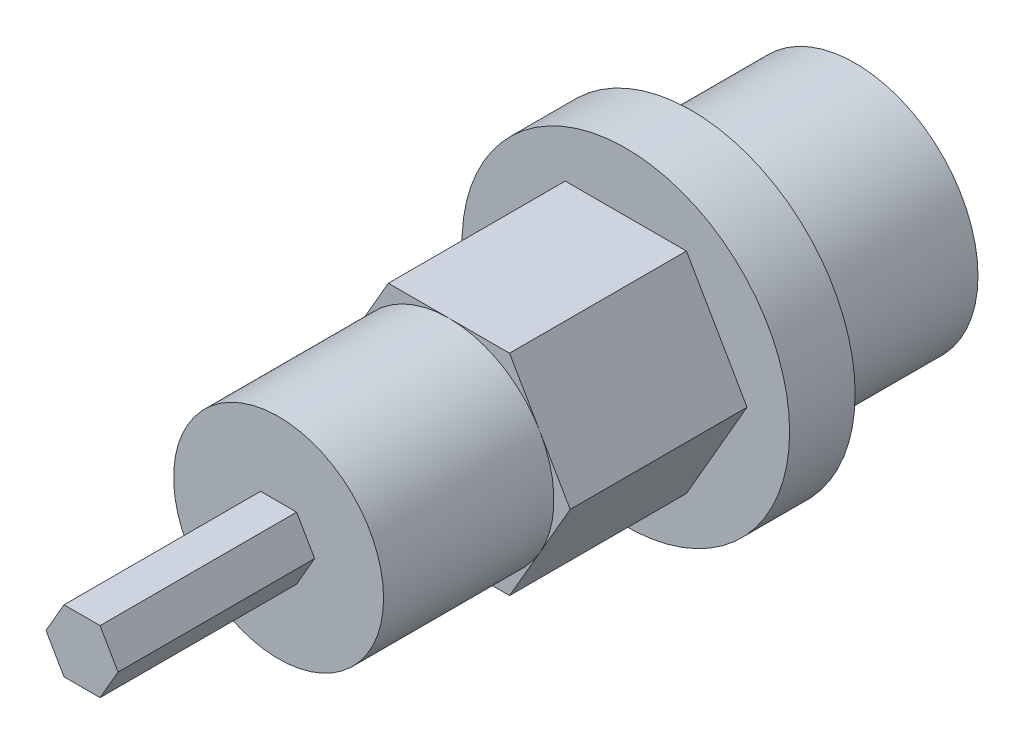
from build123d import *

# Parameters (mm, degrees)
SKETCH1_R           = 3.75
BOSS_EXTRUDE1_DEPTH = 5
SKETCH2_R           = 5
BOSS_EXTRUDE2_DEPTH = 2
BOSS_EXTRUDE3_DEPTH = 5.4
SKETCH4_R           = 3.204293994
BOSS_EXTRUDE4_DEPTH = 5.2
BOSS_EXTRUDE5_DEPTH = 6


with BuildPart() as part:
    # Sketch1 → Boss-Extrude1 (new body)
    with BuildSketch(Plane.XY):
        Circle(SKETCH1_R)
    extrude(amount=BOSS_EXTRUDE1_DEPTH)

    # Sketch2 → Boss-Extrude2 (add)
    with BuildSketch(Plane.XY.offset(5)):
        Circle(SKETCH2_R)
    extrude(amount=BOSS_EXTRUDE2_DEPTH)

    # Sketch3 → Boss-Extrude3 (add)
    with BuildSketch(Plane.XY.offset(7)):
        Polygon((3.7, 0), (1.85, 3.204293994), (-1.85, 3.204293994), (-3.7, 0), (-1.85, -3.204293994), (1.85, -3.204293994), align=None)
    extrude(amount=BOSS_EXTRUDE3_DEPTH)

    # Sketch4 → Boss-Extrude4 (add)
    with BuildSketch(Plane.XY.offset(12.4)):
        Circle(SKETCH4_R)
    extrude(amount=BOSS_EXTRUDE4_DEPTH)

    # Sketch5 → Boss-Extrude5 (add)
    with BuildSketch(Plane.XY.offset(17.6)):
        Polygon((1.1, 0), (0.55, 0.952627944), (-0.55, 0.952627944), (-1.1, 0), (-0.55, -0.952627944), (0.55, -0.952627944), align=None)
    extrude(amount=BOSS_EXTRUDE5_DEPTH)


solid = part.part
